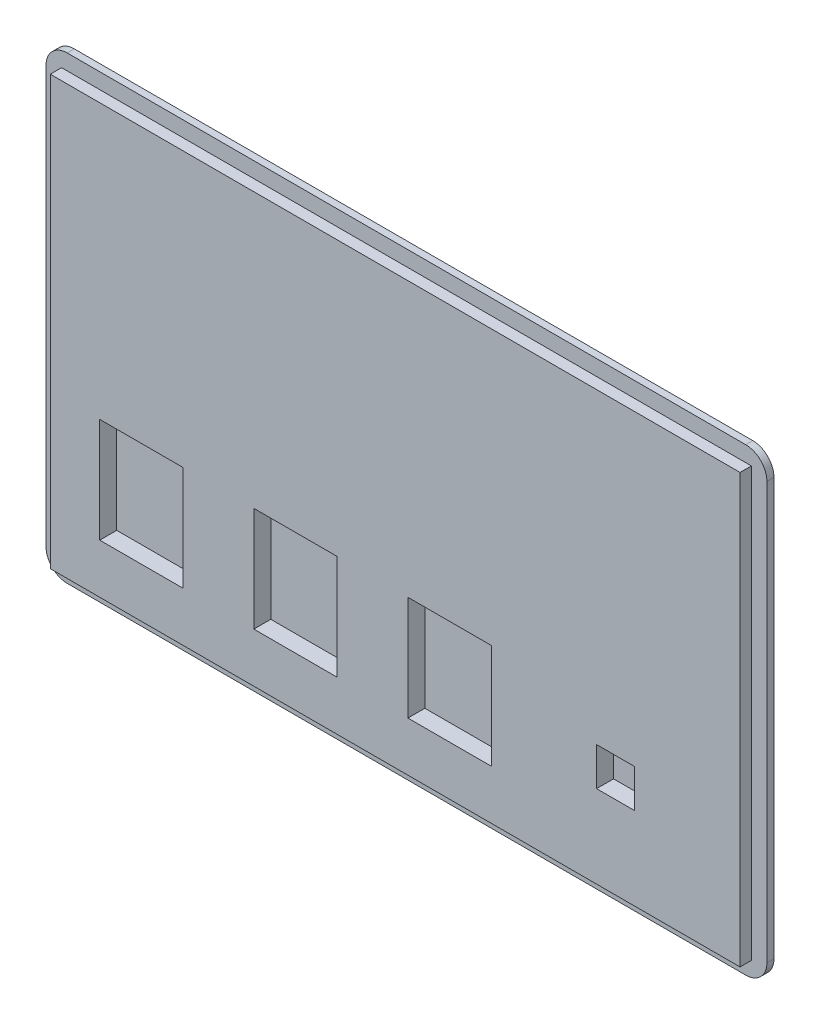
from build123d import *

# Parameters (mm, degrees)
SKICA1_W                = 97.6
SKICA1_H                = 60.6
SKICA1_W_2              = 11.8
SKICA1_H_2              = 14.8
SKICA1_W_3              = 5.4
SKICA1_H_3              = 5.4
P_IDAT_VYSUNUT_M1_DEPTH = 2.6
SKICA1_3_W              = 102
SKICA1_3_H              = 65
SKICA1_3_W_2            = 97.6
SKICA1_3_H_2            = 60.6
P_IDAT_VYSUNUT_M2_DEPTH = 1
SKICA1_5_W              = 97.6
SKICA1_5_H              = 60.6
P_IDAT_VYSUNUT_M3_DEPTH = 0.2
ZAOBLIT1_R              = 3


with BuildPart() as part:
    # Skica1 → Přidat vysunutím1 (new body)
    with BuildSketch(Plane.XY):
        with Locations((51, 32.5)):
            Rectangle(SKICA1_W, SKICA1_H)
        with Locations((15.1, 16.6)):
            Rectangle(SKICA1_W_2, SKICA1_H_2, mode=Mode.SUBTRACT)
        with Locations((36.9, 16.6)):
            Rectangle(SKICA1_W_2, SKICA1_H_2, mode=Mode.SUBTRACT)
        with Locations((58.7, 16.6)):
            Rectangle(SKICA1_W_2, SKICA1_H_2, mode=Mode.SUBTRACT)
        with Locations((82.2, 16.6)):
            Rectangle(SKICA1_W_3, SKICA1_H_3, mode=Mode.SUBTRACT)
    extrude(amount=P_IDAT_VYSUNUT_M1_DEPTH)

    # Skica1<3> → Přidat vysunutím2 (add)
    with BuildSketch(Plane.XY):
        with Locations((51, 32.5)):
            Rectangle(SKICA1_3_W, SKICA1_3_H)
        with Locations((51, 32.5)):
            Rectangle(SKICA1_3_W_2, SKICA1_3_H_2, mode=Mode.SUBTRACT)
    extrude(amount=P_IDAT_VYSUNUT_M2_DEPTH)

    # Skica1<5> → Přidat vysunutím3 (add)
    with BuildSketch(Plane.XY):
        with Locations((51, 32.5)):
            Rectangle(SKICA1_5_W, SKICA1_5_H)
    extrude(amount=P_IDAT_VYSUNUT_M3_DEPTH)

    # Zaoblit1
    zaoblit1_edges = [part.edges().sort_by_distance(p)[0] for p in [
        (102, 65, 0.5),
        (0, 65, 0.5),
        (0, 0, 0.5),
        (102, 0, 0.5),
    ]]
    fillet(zaoblit1_edges, radius=ZAOBLIT1_R)


solid = part.part
